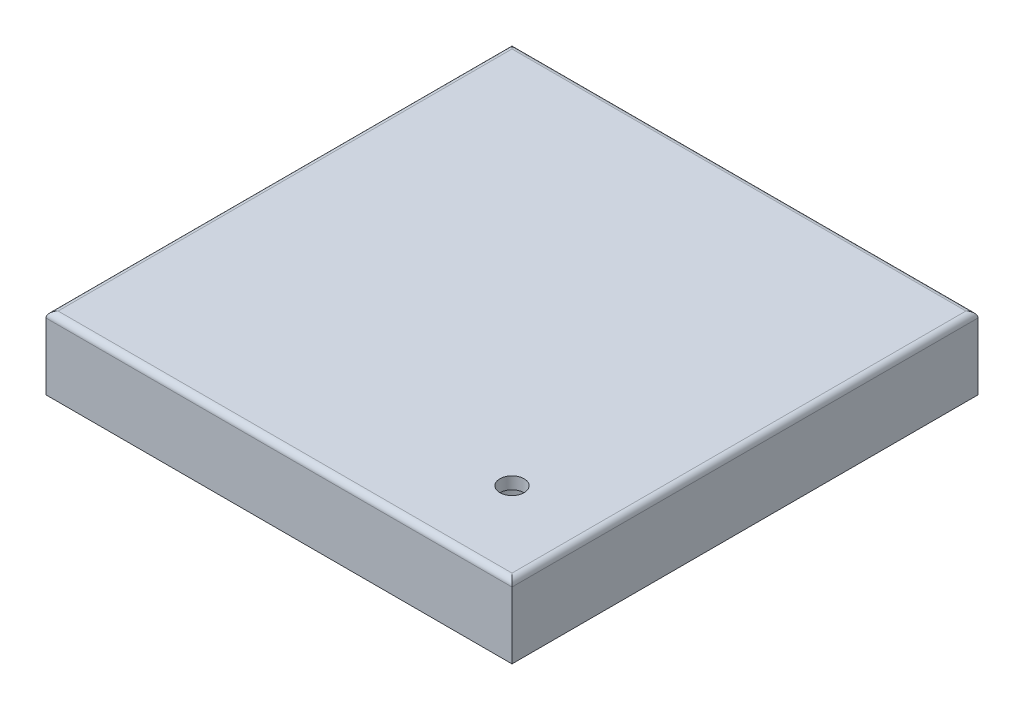
from build123d import *

# Parameters (mm, degrees)
SKETCH1_W           = 77
SKETCH1_H           = 77
BOSS_EXTRUDE1_DEPTH = 2
BOSS_EXTRUDE2_START = 8
SKETCH3_W           = 70
SKETCH3_H           = 70
SKETCH3_W_2         = 66
SKETCH3_H_2         = 66
BOSS_EXTRUDE2_DEPTH = 5
SKETCH5_W           = 77
SKETCH5_H           = 77
SKETCH5_W_2         = 70
SKETCH5_H_2         = 70
BOSS_EXTRUDE3_DEPTH = 10
SKETCH7_W           = 15
SKETCH7_H           = 3
CUT_EXTRUDE2_DEPTH  = 10
CHAMFER1_SIZE       = 2
SKETCH9_R           = 8
SKETCH9_R_2         = 6
BOSS_EXTRUDE6_DEPTH = 5
SKETCH10_R          = 2
CUT_EXTRUDE3_DEPTH  = 5
FILLET1_R           = 1


with BuildPart() as part:
    # Sketch1 → Boss-Extrude1 (new body)
    with BuildSketch(Plane(origin=(0, 0, 0), x_dir=(1, 0, 0), z_dir=(0, 1, 0))):
        with Locations((-9, 25.054332031)):
            Rectangle(SKETCH1_W, SKETCH1_H)
    extrude(amount=BOSS_EXTRUDE1_DEPTH)

    # Sketch5 → Boss-Extrude3 (add)
    with BuildSketch(Plane.XZ):
        with Locations((-9, -25.054332031)):
            Rectangle(SKETCH5_W, SKETCH5_H)
        with Locations((-9, -25.054332031)):
            Rectangle(SKETCH5_W_2, SKETCH5_H_2, mode=Mode.SUBTRACT)
    extrude(amount=BOSS_EXTRUDE3_DEPTH)

    # Sketch9 → Boss-Extrude6 (add)
    with BuildSketch(Plane.XZ):
        with Locations(Location((16, -0.054332031, 0), (0, 0, 90))):
            Circle(SKETCH9_R)
        with Locations(Location((16, -0.054332031, 0), (0, 0, 270))):
            Circle(SKETCH9_R_2, mode=Mode.SUBTRACT)
    extrude(amount=BOSS_EXTRUDE6_DEPTH)

    # Sketch10 → Cut-Extrude3 (cut)
    with BuildSketch(Plane.XZ):
        with Locations(Location((16, -0.054332031, 0), (0, 0, 270))):
            Circle(SKETCH10_R)
    extrude(amount=-CUT_EXTRUDE3_DEPTH, mode=Mode.SUBTRACT)

    # Fillet1
    fillet1_edges = [part.edges().sort_by_distance(p)[0] for p in [
        (-47.5, 2, -25.054332031),
        (-9, 2, 13.445667969),
        (29.5, 2, -25.054332031),
        (-9, 2, -63.554332031),
    ]]
    fillet(fillet1_edges, radius=FILLET1_R)


with BuildPart() as body_2:
    # Sketch3 → Boss-Extrude2 (new body)
    with BuildSketch(Plane.XZ.offset(BOSS_EXTRUDE2_START)):
        with Locations((-9, -25.054332031)):
            Rectangle(SKETCH3_W, SKETCH3_H)
        with Locations((-9, -25.054332031)):
            Rectangle(SKETCH3_W_2, SKETCH3_H_2, mode=Mode.SUBTRACT)
    extrude(amount=BOSS_EXTRUDE2_DEPTH)

    # Sketch7 → Cut-Extrude2 (cut)
    with BuildSketch(Plane(origin=(0, 0, -63.554332031), x_dir=(-1, 0, 0), z_dir=(0, 0, -1))):
        with Locations((24.5, -11.5)):
            Rectangle(SKETCH7_W, SKETCH7_H)
    extrude(amount=-CUT_EXTRUDE2_DEPTH, mode=Mode.SUBTRACT)

    # Chamfer1
    chamfer1_edges = [body_2.edges().sort_by_distance(p)[0] for p in [
        (-42, -8, -25.054332031),
        (-9, -8, -58.054332031),
        (24, -8, -25.054332031),
        (-9, -8, 7.945667969),
    ]]
    chamfer(chamfer1_edges, length=CHAMFER1_SIZE - 0.0001)  # a hair under: the kernel refuses the full size


solid = Compound([part.part, body_2.part])
